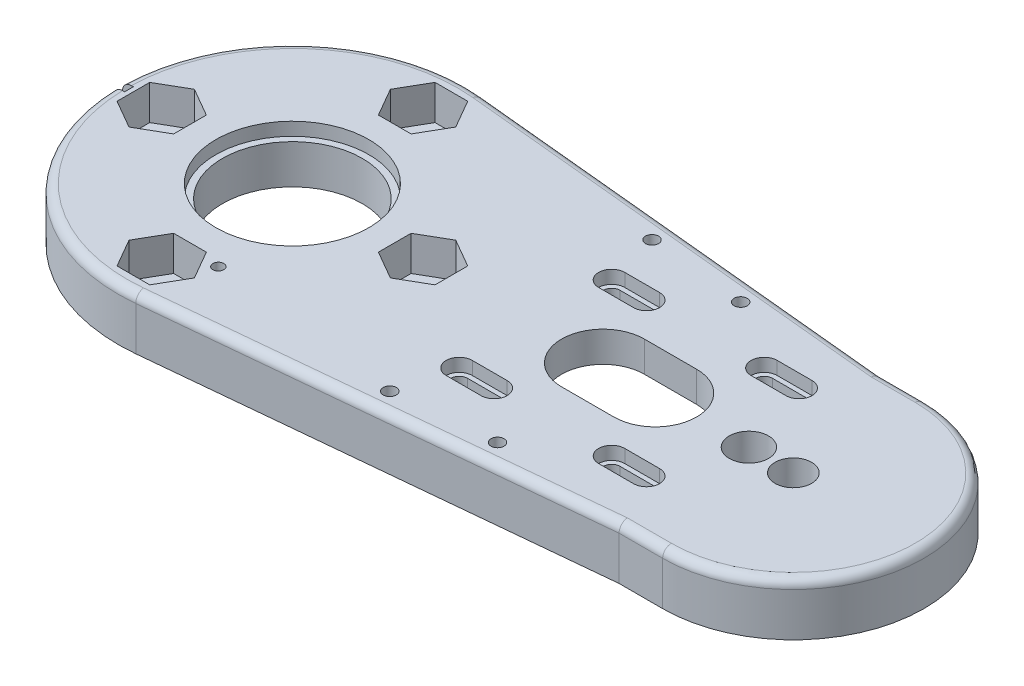
from build123d import *

# Parameters (mm, degrees)
SKETCH1_R            = 10
BOSS_EXTRUDE1_DEPTH  = 12
SKETCH2_R            = 17.55
CUT_EXTRUDE1_DEPTH   = 3
CUT_EXTRUDE2_DEPTH   = 12
SKETCH4_R            = 4
CUT_EXTRUDE3_DEPTH   = 12
SKETCH5_R            = 16.05
CUT_EXTRUDE4_DEPTH   = 113.720894248
CUT_EXTRUDE6_DEPTH   = 8
CUT_EXTRUDE7_DEPTH   = 3
SKETCH11_R           = 4.2
BOSS_EXTRUDE2_DEPTH  = 12
CUT_EXTRUDE_1_DEPTH  = 151.685102117
SKETCH_1_R           = 4.5
CUT_EXTRUDE_4_DEPTH  = 151.894002532
SKETCH6_W            = 55
SKETCH6_H            = 45.3
CUT_EXTRUDE_6_DEPTH  = 5
SKETCH_6_R           = 1.25
CUT_EXTRUDE_9_DEPTH  = 3
SKETCH_7_R           = 1.5
CUT_EXTRUDE_10_DEPTH = 151.894002532
CUT_EXTRUDE_11_DEPTH = 2.5
FILLET_1_R           = 2
FILLET_2_R           = 2
SKETCH_8_W           = 2
SKETCH_8_H           = 7.197706212
CUT_EXTRUDE_12_DEPTH = 2.5


with BuildPart() as part:
    # Sketch1 → Boss-Extrude1 (new body)
    with BuildSketch(Plane(origin=(0, 0, 0), x_dir=(1, 0, 0), z_dir=(0, 1, 0))):
        with BuildLine():
            Line((3.862942675, 39.81303397), (105, 30))
            Line((105, 30), (105, -30))
            Line((105, -30), (3.862942675, -39.81303397))
            ThreePointArc((3.862942675, -39.81303397), (-40, 0), (3.862942675, 39.81303397))
        make_face()
        with Locations(Location((0, 0, 0), (0, 0, 270))):
            Circle(SKETCH1_R, mode=Mode.SUBTRACT)
    extrude(amount=BOSS_EXTRUDE1_DEPTH)

    # Sketch2 → Cut-Extrude1 (cut)
    with BuildSketch(Plane(origin=(0, 12, 0), x_dir=(1, 0, 0), z_dir=(0, 1, 0))):
        with Locations(Location((0, 0, 0), (0, 0, 270))):
            Circle(SKETCH2_R)
    extrude(amount=-CUT_EXTRUDE1_DEPTH, mode=Mode.SUBTRACT)

    # Sketch3 → Cut-Extrude2 (cut)
    with BuildSketch(Plane(origin=(0, 12, 0), x_dir=(1, 0, 0), z_dir=(0, 1, 0))):
        with BuildLine():
            Line((71.3, 9.5), (83.3, 9.5))
            ThreePointArc((83.3, 9.5), (92.8, 0), (83.3, -9.5))
            Line((83.3, -9.5), (71.3, -9.5))
            ThreePointArc((71.3, -9.5), (61.8, 0), (71.3, 9.5))
        make_face()
    extrude(amount=-CUT_EXTRUDE2_DEPTH, mode=Mode.SUBTRACT)

    # Sketch4 → Cut-Extrude3 (cut)
    with BuildSketch(Plane(origin=(0, 12, 0), x_dir=(1, 0, 0), z_dir=(0, 1, 0))):
        with Locations(Location((30, 0, 0), (0, 0, 270))):
            Circle(SKETCH4_R)
        with Locations(Location((0, -30, 0), (0, 0, 270))):
            Circle(SKETCH4_R)
        with Locations(Location((-30, 0, 0), (0, 0, 270))):
            Circle(SKETCH4_R)
        with Locations(Location((0, 30, 0), (0, 0, 270))):
            Circle(SKETCH4_R)
    extrude(amount=-CUT_EXTRUDE3_DEPTH, mode=Mode.SUBTRACT)

    # Sketch5 → Cut-Extrude4 (cut, through all)
    with BuildSketch(Plane.XZ.offset(-9)):
        with Locations(Location((0, 0, 0), (0, 0, 270))):
            Circle(SKETCH5_R)
    extrude(amount=CUT_EXTRUDE4_DEPTH, mode=Mode.SUBTRACT)

    # Sketch7 → Cut-Extrude6 (cut)
    with BuildSketch(Plane(origin=(0, 12, 0), x_dir=(1, 0, 0), z_dir=(0, 1, 0))):
        Polygon((-7.505553499, 30), (-3.75277675, 23.5), (3.75277675, 23.5), (7.505553499, 30), (3.75277675, 36.5), (-3.75277675, 36.5), align=None)
        Polygon((-30, -7.505553499), (-23.5, -3.75277675), (-23.5, 3.75277675), (-30, 7.505553499), (-36.5, 3.75277675), (-36.5, -3.75277675), align=None)
        Polygon((30, 7.505553499), (23.5, 3.75277675), (23.5, -3.75277675), (30, -7.505553499), (36.5, -3.75277675), (36.5, 3.75277675), align=None)
        Polygon((7.505553499, -30), (3.75277675, -23.5), (-3.75277675, -23.5), (-7.505553499, -30), (-3.75277675, -36.5), (3.75277675, -36.5), align=None)
    extrude(amount=-CUT_EXTRUDE6_DEPTH, mode=Mode.SUBTRACT)

    # Sketch9 → Cut-Extrude7 (cut)
    with BuildSketch(Plane(origin=(0, 12, 0), x_dir=(1, 0, 0), z_dir=(0, 1, 0))):
        with BuildLine():
            Line((55.8, 20.5), (63.8, 20.5))
            ThreePointArc((63.8, 20.5), (66.8, 17.5), (63.8, 14.5))
            Line((63.8, 14.5), (55.8, 14.5))
            ThreePointArc((55.8, 14.5), (52.8, 17.5), (55.8, 20.5))
        make_face()
        with BuildLine():
            Line((90.8, 20.5), (98.8, 20.5))
            ThreePointArc((98.8, 20.5), (101.8, 17.5), (98.8, 14.5))
            Line((98.8, 14.5), (90.8, 14.5))
            ThreePointArc((90.8, 14.5), (87.8, 17.5), (90.8, 20.5))
        make_face()
        with BuildLine():
            Line((55.8, -14.5), (63.8, -14.5))
            ThreePointArc((63.8, -14.5), (66.8, -17.5), (63.8, -20.5))
            Line((63.8, -20.5), (55.8, -20.5))
            ThreePointArc((55.8, -20.5), (52.8, -17.5), (55.8, -14.5))
        make_face()
        with BuildLine():
            Line((90.8, -14.5), (98.8, -14.5))
            ThreePointArc((98.8, -14.5), (101.8, -17.5), (98.8, -20.5))
            Line((98.8, -20.5), (90.8, -20.5))
            ThreePointArc((90.8, -20.5), (87.8, -17.5), (90.8, -14.5))
        make_face()
    extrude(amount=-CUT_EXTRUDE7_DEPTH, mode=Mode.SUBTRACT)

    # Sketch11 → Boss-Extrude2 (add)
    with BuildSketch(Plane(origin=(0, 12, 0), x_dir=(1, 0, 0), z_dir=(0, 1, 0))):
        with BuildLine():
            Line((105, -30), (105, 30))
            Line((105, 30), (115, 30))
            ThreePointArc((115, 30), (145, 0), (115, -30))
            Line((115, -30), (105, -30))
        make_face()
        with Locations(Location((115, 0, 0), (0, 0, 270))):
            Circle(SKETCH11_R, mode=Mode.SUBTRACT)
    extrude(amount=-BOSS_EXTRUDE2_DEPTH)

    # Sketch10 → 切除-拉伸1 (cut, through all)
    with BuildSketch(Plane(origin=(0, 9, 0), x_dir=(1, 0, 0), z_dir=(0, 1, 0))):
        with BuildLine():
            Line((55.8, 15.6), (63.8, 15.6))
            ThreePointArc((63.8, 15.6), (65.7, 17.5), (63.8, 19.4))
            Line((63.8, 19.4), (55.8, 19.4))
            ThreePointArc((55.8, 19.4), (53.9, 17.5), (55.8, 15.6))
        make_face()
        with BuildLine():
            Line((90.8, 15.6), (98.8, 15.6))
            ThreePointArc((98.8, 15.6), (100.7, 17.5), (98.8, 19.4))
            Line((98.8, 19.4), (90.8, 19.4))
            ThreePointArc((90.8, 19.4), (88.9, 17.5), (90.8, 15.6))
        make_face()
        with BuildLine():
            Line((55.8, -19.4), (63.8, -19.4))
            ThreePointArc((63.8, -19.4), (65.7, -17.5), (63.8, -15.6))
            Line((63.8, -15.6), (55.8, -15.6))
            ThreePointArc((55.8, -15.6), (53.9, -17.5), (55.8, -19.4))
        make_face()
        with BuildLine():
            Line((90.8, -19.4), (98.8, -19.4))
            ThreePointArc((98.8, -19.4), (100.7, -17.5), (98.8, -15.6))
            Line((98.8, -15.6), (90.8, -15.6))
            ThreePointArc((90.8, -15.6), (88.9, -17.5), (90.8, -19.4))
        make_face()
    extrude(amount=-CUT_EXTRUDE_1_DEPTH, mode=Mode.SUBTRACT)

    # 草图1 → 切除-拉伸4 (cut, through all)
    with BuildSketch(Plane(origin=(0, 12, 0), x_dir=(1, 0, 0), z_dir=(0, 1, 0))):
        with Locations(Location((104.8, 0, 0), (0, 0, 270))):
            Circle(SKETCH_1_R)
    extrude(amount=-CUT_EXTRUDE_4_DEPTH, mode=Mode.SUBTRACT)

    # Sketch6 → 切除-拉伸6 (cut)
    with BuildSketch(Plane.XZ):
        with Locations((77.3, 0)):
            Rectangle(SKETCH6_W, SKETCH6_H)
    extrude(amount=-CUT_EXTRUDE_6_DEPTH, mode=Mode.SUBTRACT)

    # 草图6 → 切除-拉伸9 (cut)
    with BuildSketch(Plane(origin=(0, 12, 0), x_dir=(1, 0, 0), z_dir=(0, 1, 0))):
        with Locations(Location((7.999999657, -25, 0), (0, 0, 270))):
            Circle(SKETCH_6_R)
    extrude(amount=-CUT_EXTRUDE_9_DEPTH, mode=Mode.SUBTRACT)

    # 草图7 → 切除-拉伸10 (cut, through all)
    with BuildSketch(Plane.XZ):
        with Locations(Location((75, -27.910812583, 0), (0, 0, 270))):
            Circle(SKETCH_7_R)
        with Locations(Location((75, 27.910812583, 0), (0, 0, 270))):
            Circle(SKETCH_7_R)
        with Locations(Location((52.460378125, -30.097766416, 0), (0, 0, 270))):
            Circle(SKETCH_7_R)
        with Locations(Location((52.460378125, 30.097766416, 0), (0, 0, 270))):
            Circle(SKETCH_7_R)
    extrude(amount=-CUT_EXTRUDE_10_DEPTH, mode=Mode.SUBTRACT)

    # 草图4 → 切除-拉伸11 (cut)
    with BuildSketch(Plane.XZ):
        Polygon((75, 24.735386103), (77.75, 26.323099343), (77.75, 29.498525824), (75, 31.086239064), (72.25, 29.498525824), (72.25, 26.323099343), align=None)
        Polygon((75, -31.086239064), (77.75, -29.498525824), (77.75, -26.323099343), (75, -24.735386103), (72.25, -26.323099343), (72.25, -29.498525824), align=None)
        Polygon((52.460378125, 26.922339935), (55.210378125, 28.510053176), (55.210378125, 31.685479656), (52.460378125, 33.273192896), (49.710378125, 31.685479656), (49.710378125, 28.510053176), align=None)
        Polygon((52.460378125, -33.273192896), (55.210378125, -31.685479656), (55.210378125, -28.510053176), (52.460378125, -26.922339935), (49.710378125, -28.510053176), (49.710378125, -31.685479656), align=None)
    extrude(amount=-CUT_EXTRUDE_11_DEPTH, mode=Mode.SUBTRACT)

    # 圆角1
    # the kernel refuses this fillet: 2 mm, written as the material it takes off along each edge
    with BuildSketch(Plane(origin=(3.862942675, 12, -39.81303397), x_dir=(0, -1, 0), z_dir=(0.9953258492472392, 0, 0.09657356688174112))) as fillet_1_piece_1_section:
        with BuildLine():
            CenterArc((FILLET_1_R, -FILLET_1_R), FILLET_1_R, 90, 90)
            Line((0, -FILLET_1_R), (0, 0))
            Line((0, 0), (FILLET_1_R, 0))
        make_face()
    fillet_1_piece_1 = extrude(amount=106.612007165, mode=Mode.PRIVATE)
    fillet_1_piece_1 = split(fillet_1_piece_1, bisect_by=Plane(origin=(52.168611778, 11.535533923, -30), z_dir=(0, 0, -1)), keep=Keep.TOP, mode=Mode.PRIVATE)
    add(fillet_1_piece_1, mode=Mode.SUBTRACT)
    with BuildSketch(Plane(origin=(0, 12, 0), x_dir=(0.09657356688174115, 0, 0.9953258492472392), z_dir=(0.9953258492472392, 0, -0.09657356688174115))) as fillet_1_piece_2:
        with BuildLine():
            CenterArc((40 - FILLET_1_R, FILLET_1_R), FILLET_1_R, 270, 90)
            Line((40 - FILLET_1_R, 0), (40, 0))
            Line((40, 0), (40, FILLET_1_R))
        make_face()
    revolve(axis=Axis((0, 12, 0), (0, -1, 0)), revolution_arc=191.083790079, mode=Mode.SUBTRACT)
    with BuildSketch(Plane(origin=(109.976629246, 12, 29.517132166), x_dir=(-0.09657356688174114, 0, -0.9953258492472393), z_dir=(-0.9953258492472392, 0, 0.09657356688174112))) as fillet_1_piece_3_section:
        with BuildLine():
            CenterArc((FILLET_1_R, FILLET_1_R), FILLET_1_R, 180, 90)
            Line((0, FILLET_1_R), (0, 0))
            Line((0, 0), (FILLET_1_R, 0))
        make_face()
    fillet_1_piece_3 = extrude(amount=106.612007165, mode=Mode.PRIVATE)
    fillet_1_piece_3 = split(fillet_1_piece_3, bisect_by=Plane(origin=(52.168611778, 11.535533923, 30), z_dir=(0, 0, 1)), keep=Keep.TOP, mode=Mode.PRIVATE)
    add(fillet_1_piece_3, mode=Mode.SUBTRACT)

    # 圆角2
    fillet_2_edges = [part.edges().sort_by_distance(p)[0] for p in [
        (99.645199693, 12, 30),
        (99.645199693, 12, -30),
        (145, 12, 0),
    ]]
    fillet(fillet_2_edges, radius=FILLET_2_R)

    # 草图8 → 切除-拉伸12 (cut)
    with BuildSketch(Plane.ZY.offset(40)):
        with Locations((0, 8.401146894)):
            Rectangle(SKETCH_8_W, SKETCH_8_H)
    extrude(amount=-CUT_EXTRUDE_12_DEPTH, mode=Mode.SUBTRACT)


solid = part.part
